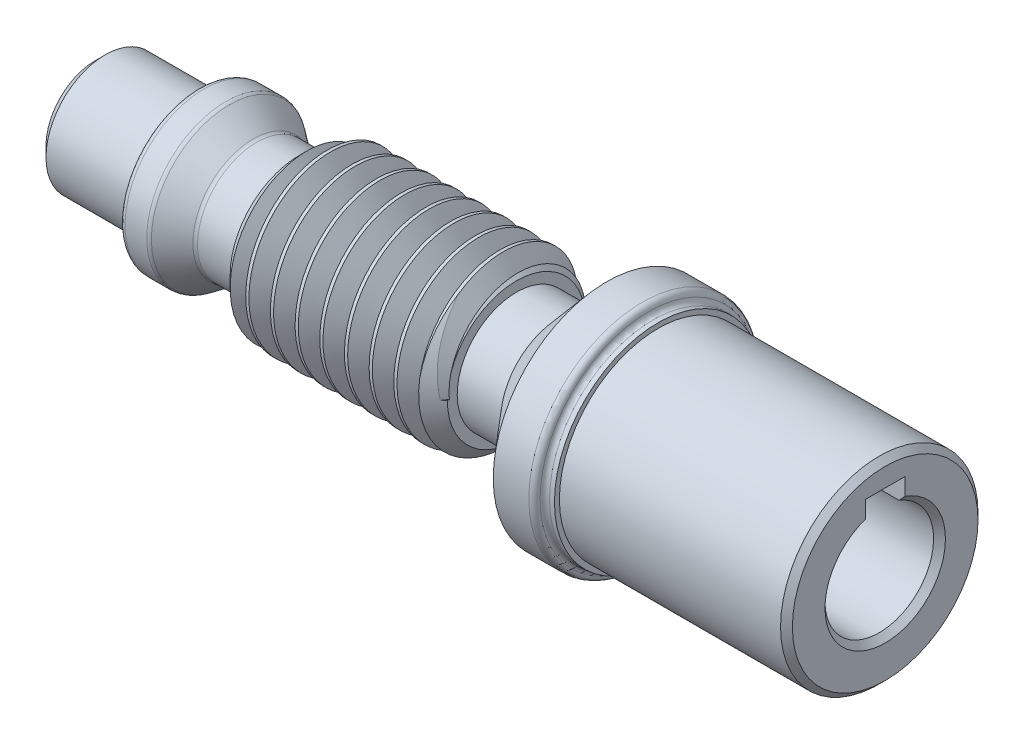
from build123d import *

# Parameters (mm, degrees)
ZKOSEN_1_SIZE                    = 0.6
ZAOBLIT1_R                       = 0.6
ZKOSEN_2_SIZE                    = 1
ODEBRAT_VYSUNUT_M1_DEPTH         = 29
ZKOSEN_3_SIZE                    = 0.6
SKICA3_R                         = 2.25
ODEBRAT_VYSUNUT_M2_DEPTH         = 3
ODEBRAT_VYSUNUT_M2_DRAFT         = -32.5
ODEBRAT_TA_EN_M_PO_K_IVCE1_PITCH = 2.5


with BuildPart() as part:
    # Skica1 → Rotovat1 (revolve)
    with BuildSketch(Plane.XY, mode=Mode.PRIVATE) as rotovat1_sk:
        with BuildLine():
            Line((-40, 0), (40, 0))
            Line((40, 0), (40, 10))
            Line((40, 10), (17, 10))
            Line((17, 10), (17, 10.5))
            Line((17, 10.5), (16.5, 10.5))
            ThreePointArc((16.5, 10.5), (16.146446609, 10.646446609), (16, 11))
            Line((16, 11), (16, 11.5))
            Line((16, 11.5), (11.8, 11.5))
            Line((11.8, 11.5), (7.05, 6))
            Line((7.05, 6), (2.65, 6))
            Line((2.65, 6), (2.65, 7))
            Line((2.65, 7), (1.15, 8.5))
            Line((1.15, 8.5), (-17.85, 8.5))
            Line((-17.85, 8.5), (-19.35, 7))
            Line((-19.35, 7), (-19.35, 6))
            Line((-19.35, 6), (-23.85, 6))
            Line((-23.85, 6), (-26.6, 8))
            Line((-26.6, 8), (-29.6, 8))
            Line((-29.6, 8), (-29.6, 6))
            ThreePointArc((-29.6, 6), (-30.1, 5.5), (-30.6, 6))
            Line((-30.6, 6), (-40, 6))
            Line((-40, 6), (-40, 0))
        make_face()
    revolve(rotovat1_sk.sketch.rotate(Axis((-66.872927267, 0, 0), (1, 0, 0)), 90), axis=Axis((-66.872927267, 0, 0), (1, 0, 0)))

    # Zkosení1
    zkosen_1_edges = [part.edges().sort_by_distance(p)[0] for p in [
        (40, 0, -10),
    ]]
    chamfer(zkosen_1_edges, length=ZKOSEN_1_SIZE)

    # Zaoblit1
    zaoblit1_edges = [part.edges().sort_by_distance(p)[0] for p in [
        (-29.6, 0, -8),
        (-23.85, 0, -6),
        (-26.6, 0, -8),
        (16, 0, -11.5),
    ]]
    fillet(zaoblit1_edges, radius=ZAOBLIT1_R)

    # Zkosení2
    zkosen_2_edges = [part.edges().sort_by_distance(p)[0] for p in [
        (-40, 0, -6),
    ]]
    chamfer(zkosen_2_edges, length=ZKOSEN_2_SIZE)

    # Skica2 → Odebrat vysunutím1 (cut)
    with BuildSketch(Plane(origin=(40, 0, 0), x_dir=(0, 0, -1), z_dir=(1, 0, 0))):
        with BuildLine():
            Line((-2, 7.5), (2, 7.5))
            Line((2, 7.5), (2, 5.123475383))
            ThreePointArc((2, 5.123475383), (0, -5.5), (-2, 5.123475383))
            Line((-2, 5.123475383), (-2, 7.5))
        make_face()
    extrude(amount=-ODEBRAT_VYSUNUT_M1_DEPTH, mode=Mode.SUBTRACT)

    # Zkosení3
    zkosen_3_edges = [part.edges().sort_by_distance(p)[0] for p in [
        (40, -5.5, 0),
    ]]
    chamfer(zkosen_3_edges, length=ZKOSEN_3_SIZE)


with BuildPart() as odebrat_vysunut_m2_tool:
    # Skica3 → Odebrat vysunutím2 (with draft: the straight prism first)
    with BuildSketch(Plane.ZY.offset(40)):
        Circle(SKICA3_R)
    extrude(amount=-ODEBRAT_VYSUNUT_M2_DEPTH)
    # Odebrat vysunutím2: the draft: its side faces are tilted about the plane it starts from
    odebrat_vysunut_m2_sides = [odebrat_vysunut_m2_tool.faces().sort_by_distance(p)[0] for p in [
        (-38.5, 0, -2.25),
    ]]
    draft(odebrat_vysunut_m2_sides, Plane.ZY.offset(40), ODEBRAT_VYSUNUT_M2_DRAFT)


with BuildPart() as part_1:
    add(part.part)

    # Odebrat vysunutím2: cut by odebrat_vysunut_m2_tool
    add(odebrat_vysunut_m2_tool.part, mode=Mode.SUBTRACT)

    # Odebrat tažením po křivce1: the profile of Skica5 screwed along a right-hand helix of 8.8 turns, 10 arcs to a turn; built about Z, then put on its axis
    odebrat_ta_en_m_po_k_ivce1_z = Axis((0, 0, 0), (0, 0, 1))
    odebrat_ta_en_m_po_k_ivce1_corners = [(8.52, 0, 1.1), (8.52, 0, -1.1), (6.8, 0, 0)]
    with BuildLine(mode=Mode.PRIVATE) as odebrat_ta_en_m_po_k_ivce1_profile:
        Line(odebrat_ta_en_m_po_k_ivce1_corners[0], odebrat_ta_en_m_po_k_ivce1_corners[1])
        Line(odebrat_ta_en_m_po_k_ivce1_corners[1], odebrat_ta_en_m_po_k_ivce1_corners[2])
        Line(odebrat_ta_en_m_po_k_ivce1_corners[2], odebrat_ta_en_m_po_k_ivce1_corners[0])
    odebrat_ta_en_m_po_k_ivce1_cap = Face(odebrat_ta_en_m_po_k_ivce1_profile.wire())
    odebrat_ta_en_m_po_k_ivce1_turn_angles = [0, 18, 36, 54, 72, 90, 108, 126, 144, 162, 180, 198, 216, 234, 252, 270, 288, 306, 324, 342, 360]
    odebrat_ta_en_m_po_k_ivce1_turn_weights = [1, 0.9510565162951535, 1, 0.9510565162951535, 1, 0.9510565162951535, 1, 0.9510565162951535, 1, 0.9510565162951535, 1, 0.9510565162951535, 1, 0.9510565162951535, 1, 0.9510565162951535, 1, 0.9510565162951535, 1, 0.9510565162951535, 1]
    odebrat_ta_en_m_po_k_ivce1_turn_rails = [Edge.make_bspline([Vector(p[0], p[1], 0).rotate(odebrat_ta_en_m_po_k_ivce1_z, odebrat_ta_en_m_po_k_ivce1_turn_angles[k]) / odebrat_ta_en_m_po_k_ivce1_turn_weights[k] + Vector(0, 0, p[2] + ODEBRAT_TA_EN_M_PO_K_IVCE1_PITCH * odebrat_ta_en_m_po_k_ivce1_turn_angles[k] / 360) for k in range(21)], [0, 0, 0, 1, 1, 2, 2, 3, 3, 4, 4, 5, 5, 6, 6, 7, 7, 8, 8, 9, 9, 10, 10, 10], 2, odebrat_ta_en_m_po_k_ivce1_turn_weights) for p in odebrat_ta_en_m_po_k_ivce1_corners]
    odebrat_ta_en_m_po_k_ivce1_turn_sides = [Face.make_surface_from_curves(odebrat_ta_en_m_po_k_ivce1_turn_rails[p[0]], odebrat_ta_en_m_po_k_ivce1_turn_rails[p[1]]) for p in [(0, 1), (1, 2), (2, 0)]]
    odebrat_ta_en_m_po_k_ivce1_last_angles = [2880, 2898, 2916, 2934, 2952, 2970, 2988, 3006, 3024, 3042, 3060, 3078, 3096, 3114, 3132, 3150, 3168]
    odebrat_ta_en_m_po_k_ivce1_last_weights = [1, 0.9510565162951535, 1, 0.9510565162951535, 1, 0.9510565162951535, 1, 0.9510565162951535, 1, 0.9510565162951535, 1, 0.9510565162951535, 1, 0.9510565162951535, 1, 0.9510565162950935, 1]
    odebrat_ta_en_m_po_k_ivce1_last_rails = [Edge.make_bspline([Vector(p[0], p[1], 0).rotate(odebrat_ta_en_m_po_k_ivce1_z, odebrat_ta_en_m_po_k_ivce1_last_angles[k]) / odebrat_ta_en_m_po_k_ivce1_last_weights[k] + Vector(0, 0, p[2] + ODEBRAT_TA_EN_M_PO_K_IVCE1_PITCH * odebrat_ta_en_m_po_k_ivce1_last_angles[k] / 360) for k in range(17)], [0, 0, 0, 1, 1, 2, 2, 3, 3, 4, 4, 5, 5, 6, 6, 7, 7, 8, 8, 8], 2, odebrat_ta_en_m_po_k_ivce1_last_weights) for p in odebrat_ta_en_m_po_k_ivce1_corners]
    odebrat_ta_en_m_po_k_ivce1_last_sides = [Face.make_surface_from_curves(odebrat_ta_en_m_po_k_ivce1_last_rails[p[0]], odebrat_ta_en_m_po_k_ivce1_last_rails[p[1]]) for p in [(0, 1), (1, 2), (2, 0)]]
    odebrat_ta_en_m_po_k_ivce1 = Plane(origin=(2.65, 0, 0), x_dir=(0, 0, 1), z_dir=(-1, 0, 0)) * Solid(Shell([*[p.moved(Location((0, 0, ODEBRAT_TA_EN_M_PO_K_IVCE1_PITCH * i))) for i in range(8) for p in odebrat_ta_en_m_po_k_ivce1_turn_sides], *odebrat_ta_en_m_po_k_ivce1_last_sides, odebrat_ta_en_m_po_k_ivce1_cap, odebrat_ta_en_m_po_k_ivce1_cap.rotate(odebrat_ta_en_m_po_k_ivce1_z, 3168).moved(Location((0, 0, ODEBRAT_TA_EN_M_PO_K_IVCE1_PITCH * 3168 / 360)))]))
    add(odebrat_ta_en_m_po_k_ivce1, mode=Mode.SUBTRACT)


solid = part_1.part
